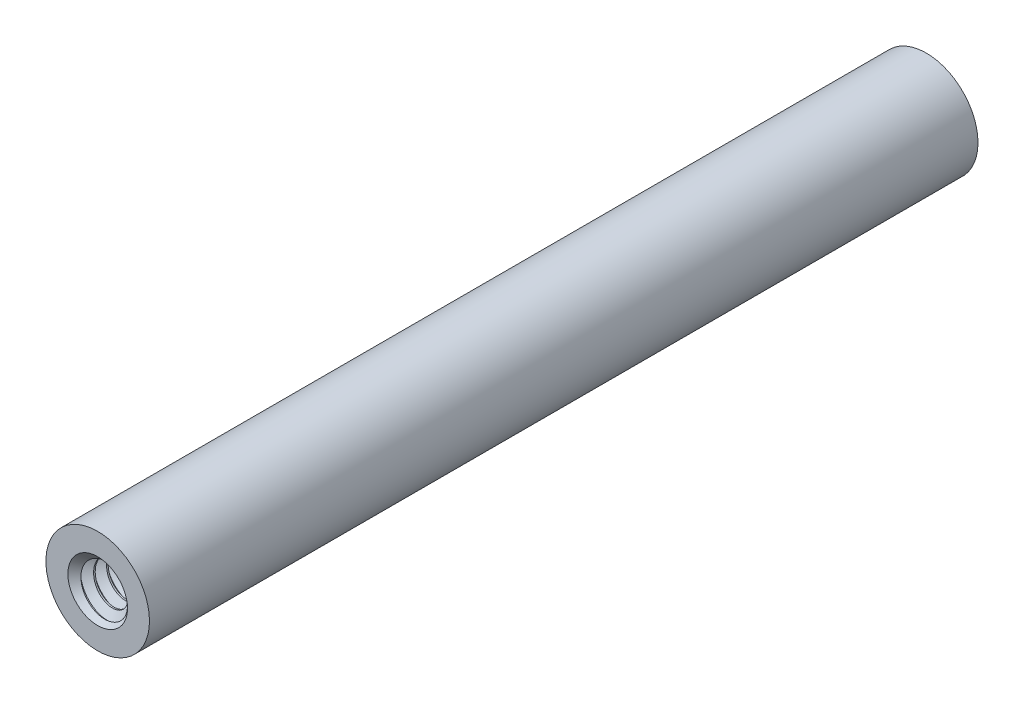
from build123d import *

# Parameters (mm, degrees)
BOSS_EXTRUDE1_START = 25.4
SKETCH13_R          = 1.7526
BOSS_EXTRUDE1_DEPTH = 9.525
CUT_SWEEP1_PITCH    = 0.79375
CIRPATTERN1_COUNT   = 2
CIRPATTERN1_ANGLE   = 180
EXTRUDE1_DEPTH      = 25.4
EXTRUDE1_DEPTH_BACK = 25.4
SKETCH1_R           = 3.175


with BuildPart() as part:
    # Sketch13 → Boss-Extrude1 (new body)
    with BuildSketch(Plane.XY.offset(BOSS_EXTRUDE1_START)):
        Circle(SKETCH13_R)
    extrude(amount=-BOSS_EXTRUDE1_DEPTH)

    # Cut-Sweep1: the profile of Sketch15 profile screwed along a right-hand helix of 13 turns, 8 arcs to a turn; built about Z, then put on its axis
    cut_sweep1_z = Axis((0, 0, 0), (0, 0, 1))
    cut_sweep1_corners = [(1.7529, 0, -0.694704455), (1.7529, 0, 0.000173205), (1.237044252, 0, -0.29765625), (1.237044252, 0, -0.396875)]
    with BuildLine(mode=Mode.PRIVATE) as cut_sweep1_profile:
        Line(cut_sweep1_corners[0], cut_sweep1_corners[1])
        Line(cut_sweep1_corners[1], cut_sweep1_corners[2])
        Line(cut_sweep1_corners[2], cut_sweep1_corners[3])
        Line(cut_sweep1_corners[3], cut_sweep1_corners[0])
    cut_sweep1_cap = Face(cut_sweep1_profile.wire())
    cut_sweep1_turn_angles = [0, 22.5, 45, 67.5, 90, 112.5, 135, 157.5, 180, 202.5, 225, 247.5, 270, 292.5, 315, 337.5, 360]
    cut_sweep1_turn_weights = [1, 0.9238795325112867, 1, 0.9238795325112867, 1, 0.9238795325112867, 1, 0.9238795325112867, 1, 0.9238795325112867, 1, 0.9238795325112867, 1, 0.9238795325112867, 1, 0.9238795325112867, 1]
    cut_sweep1_turn_rails = [Edge.make_bspline([Vector(p[0], p[1], 0).rotate(cut_sweep1_z, cut_sweep1_turn_angles[k]) / cut_sweep1_turn_weights[k] + Vector(0, 0, p[2] + CUT_SWEEP1_PITCH * cut_sweep1_turn_angles[k] / 360) for k in range(17)], [0, 0, 0, 1, 1, 2, 2, 3, 3, 4, 4, 5, 5, 6, 6, 7, 7, 8, 8, 8], 2, cut_sweep1_turn_weights) for p in cut_sweep1_corners]
    cut_sweep1_turn_sides = [Face.make_surface_from_curves(cut_sweep1_turn_rails[p[0]], cut_sweep1_turn_rails[p[1]]) for p in [(0, 1), (1, 2), (2, 3), (3, 0)]]
    cut_sweep1 = Plane(origin=(0, 0, 25.4), x_dir=(0, 1, 0), z_dir=(0, 0, -1)) * Solid(Shell([*[p.moved(Location((0, 0, CUT_SWEEP1_PITCH * i))) for i in range(13) for p in cut_sweep1_turn_sides], cut_sweep1_cap, cut_sweep1_cap.rotate(cut_sweep1_z, 4680).moved(Location((0, 0, CUT_SWEEP1_PITCH * 4680 / 360)))]))
    add(cut_sweep1, mode=Mode.SUBTRACT)

    # Boss-Extrude2 cone 1 section (through the dimple's axis) → Boss-Extrude2 (revolve)
    with BuildSketch(Plane(origin=(0, 0, 25.4), x_dir=(0, -1, 0), z_dir=(1, 0, 0))):
        Polygon((0, 0), (1.8288, 0), (0, 1.8288), align=None)
    revolve(axis=Axis((0, 0, 25.4), (0, 0, -1)))


with BuildPart() as cirpattern1_1:
    # CirPattern1: pattern copy
    add(part.part.rotate(Axis((0, 3.175, 0), (0, -1, 0)), 1 * CIRPATTERN1_ANGLE / (CIRPATTERN1_COUNT - 1)))


with BuildPart() as body_3:
    # Sketch1 → Extrude1 (new, two sides: drawn at the far end of the back side and taken through both)
    with BuildSketch(Plane.XY.offset(-EXTRUDE1_DEPTH_BACK)):
        Circle(SKETCH1_R)
    extrude(amount=EXTRUDE1_DEPTH + EXTRUDE1_DEPTH_BACK)

    # Combine1: cut CirPattern1_1, part
    add(cirpattern1_1.part, mode=Mode.SUBTRACT)
    add(part.part, mode=Mode.SUBTRACT)


solid = body_3.part
